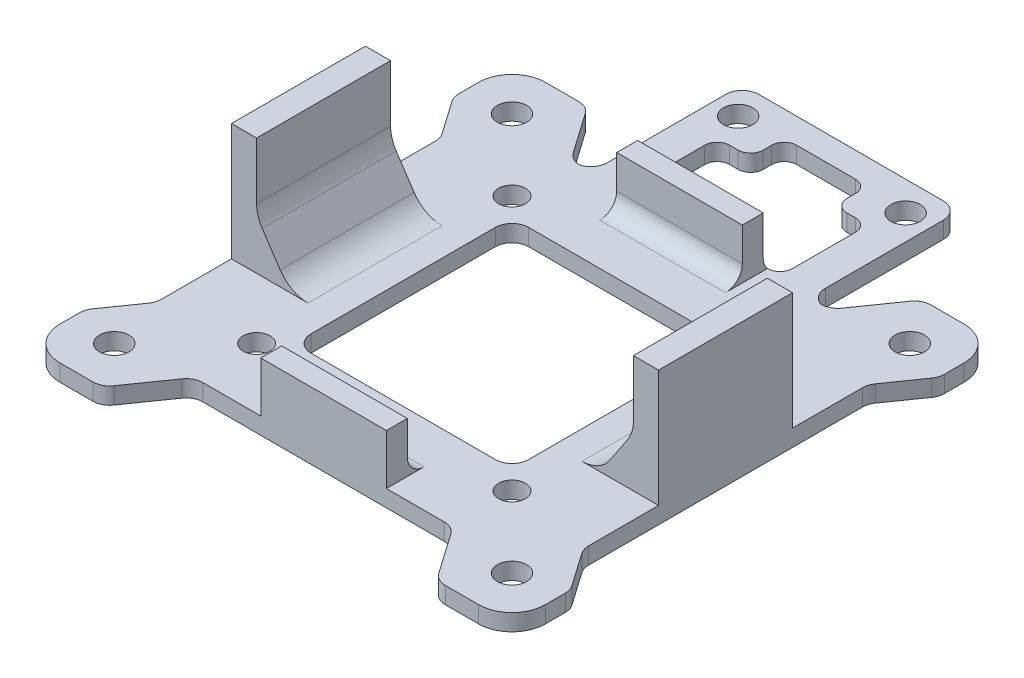
from build123d import *

# Parameters (mm, degrees)
SKETCH1_R                 = 1.75
BASE_DEPTH                = 2
SKETCH2_W                 = 7
SKETCH2_H                 = 16
SIDE_BATTERY_GUIDES_DEPTH = 14
CUT_EXTRUDE1_DEPTH        = 50.658836072
SKETCH5_W                 = 15
SKETCH5_H                 = 2.5
BOSS_EXTRUDE3_DEPTH       = 6
CUT_EXTRUDE2_DEPTH        = 44.33589736
FILLET2_R                 = 2
SKETCH7_R                 = 1.6
CUT_EXTRUDE3_DEPTH        = 44.33589736
SKETCH8_W                 = 26
SKETCH8_H                 = 18
SKETCH8_R                 = 1.75
PINOUT_BD_HOLDER_DEPTH    = 2
WEIGH_REDUCER_DEPTH       = 53.318734694
FILLET3_R                 = 4
FILLET4_R                 = 2
FILLET5_DEPTH             = 2
FILLET5_START             = -7.5
FILLET5_2_DEPTH           = 15
FILLET5_START_2           = -1
FILLET5_3_DEPTH           = 4


with BuildPart() as part:
    # Sketch1 → base (new body)
    with BuildSketch(Plane(origin=(0, 0, 0), x_dir=(1, 0, 0), z_dir=(0, 1, 0))):
        with BuildLine():
            Line((-25, 29), (25, 29))
            ThreePointArc((25, 29), (27.828427125, 27.828427125), (29, 25))
            Line((29, 25), (29, -25))
            ThreePointArc((29, -25), (27.828427125, -27.828427125), (25, -29))
            Line((25, -29), (-25, -29))
            ThreePointArc((-25, -29), (-27.828427125, -27.828427125), (-29, -25))
            Line((-29, -25), (-29, 25))
            ThreePointArc((-29, 25), (-27.828427125, 27.828427125), (-25, 29))
        make_face()
        with Locations(Location((23.75, 23.75, 0), (0, 0, 270))):
            Circle(SKETCH1_R, mode=Mode.SUBTRACT)
        with Locations(Location((23.75, -23.75, 0), (0, 0, 270))):
            Circle(SKETCH1_R, mode=Mode.SUBTRACT)
        with Locations(Location((-23.75, -23.75, 0), (0, 0, 270))):
            Circle(SKETCH1_R, mode=Mode.SUBTRACT)
        with Locations(Location((-23.75, 23.75, 0), (0, 0, 270))):
            Circle(SKETCH1_R, mode=Mode.SUBTRACT)
        with BuildLine():
            Line((-11, 13), (11, 13))
            ThreePointArc((11, 13), (12.414213562, 12.414213562), (13, 11))
            Line((13, 11), (13, -11))
            ThreePointArc((13, -11), (12.414213562, -12.414213562), (11, -13))
            Line((11, -13), (-11, -13))
            ThreePointArc((-11, -13), (-12.414213562, -12.414213562), (-13, -11))
            Line((-13, -11), (-13, 11))
            ThreePointArc((-13, 11), (-12.414213562, 12.414213562), (-11, 13))
        make_face(mode=Mode.SUBTRACT)
    extrude(amount=BASE_DEPTH)

    # Sketch2 → side battery guides (add)
    with BuildSketch(Plane(origin=(0, 2, 0), x_dir=(1, 0, 0), z_dir=(0, 1, 0))):
        with Locations((-22, 0)):
            Rectangle(SKETCH2_W, SKETCH2_H)
        with Locations((22, 0)):
            Rectangle(SKETCH2_W, SKETCH2_H)
    extrude(amount=SIDE_BATTERY_GUIDES_DEPTH)

    # Sketch4 → Cut-Extrude1 (cut, through all)
    with BuildSketch(Plane.XY.offset(8)):
        Polygon((-18.5, 16), (-22.5, 16), (-22.5, 8), (-18.5, 2), align=None)
        Polygon((18.5, 2), (18.5, 16), (22.5, 16), (22.5, 8), align=None)
    extrude(amount=-CUT_EXTRUDE1_DEPTH, mode=Mode.SUBTRACT)

    # Sketch5 → Boss-Extrude3 (add)
    with BuildSketch(Plane(origin=(0, 2, 0), x_dir=(1, 0, 0), z_dir=(0, 1, 0))):
        with Locations((0, 21.25)):
            Rectangle(SKETCH5_W, SKETCH5_H)
        with Locations((0, -21.25)):
            Rectangle(SKETCH5_W, SKETCH5_H)
    extrude(amount=BOSS_EXTRUDE3_DEPTH)

    # Sketch6 → Cut-Extrude2 (cut, through all)
    with BuildSketch(Plane(origin=(0, 2, 0), x_dir=(1, 0, 0), z_dir=(0, 1, 0))):
        Polygon((-25.5, 8), (-25.5, 17), (-29, 22), (-29, -22), (-25.5, -17), (-25.5, -8), align=None)
        Polygon((-15.45, -22.5), (-7.5, -22.5), (7.5, -22.5), (15.45, -22.5), (20, -29), (-20, -29), align=None)
        Polygon((29, 22), (29, -22), (25.5, -17), (25.5, -8), (25.5, 8), (25.5, 17), align=None)
        Polygon((-7.5, 22.5), (7.5, 22.5), (15.45, 22.5), (20, 29), (-20, 29), (-15.45, 22.5), align=None)
    extrude(amount=-CUT_EXTRUDE2_DEPTH, mode=Mode.SUBTRACT)

    # Fillet2
    fillet2_edges = [part.edges().sort_by_distance(p)[0] for p in [
        (-25.5, 1, -17),
        (-25.5, 1, 17),
        (-29, 1, 22),
        (-29, 1, -22),
        (-20, 1, 29),
        (-15.45, 1, 22.5),
        (15.45, 1, 22.5),
        (20, 1, 29),
        (25.5, 1, -17),
        (29, 1, -22),
        (29, 1, 22),
        (25.5, 1, 17),
        (-15.45, 1, -22.5),
        (-20, 1, -29),
        (20, 1, -29),
        (15.45, 1, -22.5),
    ]]
    fillet(fillet2_edges, radius=FILLET2_R)

    # Sketch7 → Cut-Extrude3 (cut, through all)
    with BuildSketch(Plane(origin=(0, 2, 0), x_dir=(1, 0, 0), z_dir=(0, 1, 0))):
        with Locations(Location((15.25, 15.25, 0), (0, 0, 270))):
            Circle(SKETCH7_R)
        with Locations(Location((15.25, -15.25, 0), (0, 0, 90))):
            Circle(SKETCH7_R)
        with Locations(Location((-15.25, -15.25, 0), (0, 0, 270))):
            Circle(SKETCH7_R)
        with Locations(Location((-15.25, 15.25, 0), (0, 0, 90))):
            Circle(SKETCH7_R)
    extrude(amount=-CUT_EXTRUDE3_DEPTH, mode=Mode.SUBTRACT)

    # Sketch8 → pinout_bd_holder (add)
    with BuildSketch(Plane(origin=(0, 2, 0), x_dir=(1, 0, 0), z_dir=(0, 1, 0))):
        with Locations((0, 31.5)):
            Rectangle(SKETCH8_W, SKETCH8_H)
        with Locations(Location((-10, 37, 0), (0, 0, 270))):
            Circle(SKETCH8_R, mode=Mode.SUBTRACT)
        with Locations(Location((10, 37, 0), (0, 0, 90))):
            Circle(SKETCH8_R, mode=Mode.SUBTRACT)
    extrude(amount=-PINOUT_BD_HOLDER_DEPTH)

    # Sketch9 → Weigh-Reducer (cut, through all)
    with BuildSketch(Plane.XZ):
        with BuildLine():
            Line((-7.5, -23), (7.5, -23))
            ThreePointArc((7.5, -23), (8.560660172, -23.439339828), (9, -24.5))
            Line((9, -24.5), (9, -32))
            ThreePointArc((9, -32), (8.560660172, -33.060660172), (7.5, -33.5))
            Line((7.5, -33.5), (6.5, -33.5))
            ThreePointArc((6.5, -33.5), (5.439339828, -33.939339828), (5, -35))
            Line((5, -35), (5, -36))
            ThreePointArc((5, -36), (4.560660172, -37.060660172), (3.5, -37.5))
            Line((3.5, -37.5), (-3.5, -37.5))
            ThreePointArc((-3.5, -37.5), (-4.560660172, -37.060660172), (-5, -36))
            Line((-5, -36), (-5, -35))
            ThreePointArc((-5, -35), (-5.439339828, -33.939339828), (-6.5, -33.5))
            Line((-6.5, -33.5), (-7.5, -33.5))
            ThreePointArc((-7.5, -33.5), (-8.560660172, -33.060660172), (-9, -32))
            Line((-9, -32), (-9, -24.5))
            ThreePointArc((-9, -24.5), (-8.560660172, -23.439339828), (-7.5, -23))
        make_face()
    extrude(amount=-WEIGH_REDUCER_DEPTH, mode=Mode.SUBTRACT)

    # Fillet3
    fillet3_edges = [part.edges().sort_by_distance(p)[0] for p in [
        (22.5, 8, 0),
        (-18.5, 2, 0),
        (18.5, 2, 0),
        (-22.5, 8, 0),
    ]]
    fillet(fillet3_edges, radius=FILLET3_R)

    # Fillet4
    fillet4_edges = [part.edges().sort_by_distance(p)[0] for p in [
        (0, 2, -20),
        (0, 2, 20),
    ]]
    fillet(fillet4_edges, radius=FILLET4_R)

    # Fillet5: read off the stored shape, not the designer's step
    # Fillet5 outline → Fillet5 (add)
    with BuildSketch(Plane(origin=(0, 0, 0), x_dir=(1, 0, 0), z_dir=(0, 1, 0))):
        with BuildLine():
            Line((-13, 22.5), (-13, 24.410589217))
            ThreePointArc((-13, 24.410589217), (-13.390245011, 23.223707219), (-14.408688877, 22.5))
            Line((-14.408688877, 22.5), (-13, 22.5))
        make_face()
        with BuildLine():
            ThreePointArc((14.408688877, 22.5), (13.390245011, 23.223707219), (13, 24.410589217))
            Line((13, 24.410589217), (13, 22.5))
            Line((13, 22.5), (14.408688877, 22.5))
        make_face()
    extrude(amount=FILLET5_DEPTH)

    # Fillet5 2 outline → Fillet5 2 (add)
    with BuildSketch(Plane.YZ.offset(FILLET5_START)):
        with BuildLine():
            ThreePointArc((2, -23), (2.615768875, -22.629171307), (3.322875656, -22.5))
            Line((3.322875656, -22.5), (2, -22.5))
            Line((2, -22.5), (2, -23))
        make_face()
    extrude(amount=FILLET5_2_DEPTH)

    # Fillet5 3 outline → Fillet5 3 (cut)
    with BuildSketch(Plane(origin=(0, 0, 0), x_dir=(1, 0, 0), z_dir=(0, 1, 0)).offset(FILLET5_START_2)):
        with BuildLine():
            ThreePointArc((-13, 38.5), (-12.414213562, 39.914213562), (-11, 40.5))
            Line((-11, 40.5), (-13, 40.5))
            Line((-13, 40.5), (-13, 38.5))
        make_face()
        with BuildLine():
            ThreePointArc((11, 40.5), (12.414213562, 39.914213562), (13, 38.5))
            Line((13, 38.5), (13, 40.5))
            Line((13, 40.5), (11, 40.5))
        make_face()
    extrude(amount=FILLET5_3_DEPTH, mode=Mode.SUBTRACT)


solid = part.part
